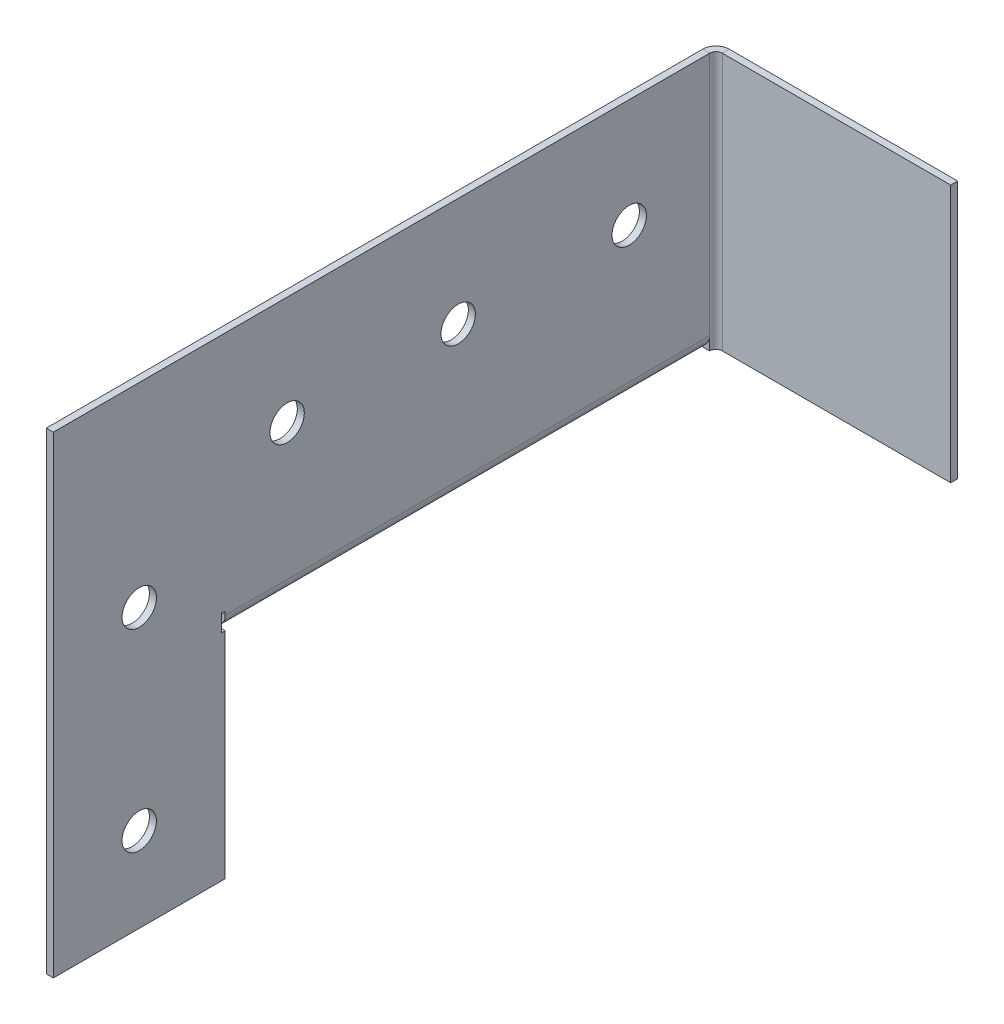
from build123d import *

# Parameters (mm, degrees)
SKETCH1_W                    = 28.1256
SKETCH1_H                    = 30
BASE_FLANGE2_DEPTH           = 0.8128
EDGE_FLANGE3_STRIP_W         = 4.7244
EDGE_FLANGE3_STRIP_H         = 0.8128
EDGE_FLANGE3_STRIP_CUT_DEPTH = 30
EDGE_FLANGE3_DEPTH           = 30
EDGE_FLANGE3_FLAT_DEPTH      = 0.8128
EDGE_FLANGE4_START           = 0.7366
EDGE_FLANGE4_DEPTH           = 56.7698
EDGE_FLANGE4_START_2         = 57.1
EDGE_FLANGE4_2_DEPTH         = 0.4064
EDGE_FLANGE4_3_DEPTH         = 56.3634
CUT_EXTRUDE1_REACH           = 93.299
SKETCH22_R                   = 2
CUT_EXTRUDE2_REACH           = 89.146


# Read off the part's stored shape, not the designer's step: Edge-Flange4
# Sheet-metal steps are written as plain solids
with BuildPart() as part:
    # Sketch1 → Base-Flange2 (new body)
    with BuildSketch(Plane.XY):
        Rectangle(SKETCH1_W, SKETCH1_H)
    extrude(amount=-BASE_FLANGE2_DEPTH)

    # Edge-Flange3 strip (across the edge) → Edge-Flange3 strip cut (cut)
    with BuildSketch(Plane(origin=(-14.0628, 15, 0), x_dir=(1, 0, 0), z_dir=(0, -1, 0))):
        with Locations((-0.8128, -0.4064)):
            Rectangle(EDGE_FLANGE3_STRIP_W, EDGE_FLANGE3_STRIP_H)
    extrude(amount=EDGE_FLANGE3_STRIP_CUT_DEPTH, mode=Mode.SUBTRACT)

    # Edge-Flange3 bend section (across the edge) → Edge-Flange3 (add)
    with BuildSketch(Plane(origin=(-14.0628, 15, 0), x_dir=(1, 0, 0), z_dir=(0, -1, 0))):
        with BuildLine():
            Line((0, 0.7366), (0.8128, 0.7366))
            ThreePointArc((0.8128, 0.7366), (1.028545145, 0.215745145), (1.5494, 0))
            Line((1.5494, 0), (1.5494, -0.8128))
            ThreePointArc((1.5494, -0.8128), (0.453808753, -0.358991247), (0, 0.7366))
        make_face()
    extrude(amount=EDGE_FLANGE3_DEPTH)

    # Edge-Flange3 profile (on flange) → Edge-Flange3 flat (add)
    with BuildSketch(Plane(origin=(-14.0628, 0, 0), x_dir=(0, -1, 0), z_dir=(-1, 0, 0))):
        Polygon((-15, 0.7366), (15, 0.7366), (15, 57.1), (40, 57.1), (40, 77.1), (-15, 77.1), align=None)
    extrude(amount=-EDGE_FLANGE3_FLAT_DEPTH)

    # Edge-Flange4 outline → Edge-Flange4 (cut)
    with BuildSketch(Plane.XY.offset(EDGE_FLANGE4_START)):
        with BuildLine():
            ThreePointArc((-13.25, -13.4506), (-13.468624211, -14.244121367), (-14.0628, -14.813707039))
            Line((-14.0628, -14.813707039), (-14.0628, -15))
            Line((-14.0628, -15), (-13.25, -15))
            Line((-13.25, -15), (-13.25, -13.4506))
        make_face()
    extrude(amount=EDGE_FLANGE4_DEPTH, mode=Mode.SUBTRACT)

    # Edge-Flange4 2 outline → Edge-Flange4 2 (cut)
    with BuildSketch(Plane.XY.offset(EDGE_FLANGE4_START_2)):
        with BuildLine():
            Line((-14.0628, -13.0442), (-14.0628, -14.813707039))
            ThreePointArc((-14.0628, -14.813707039), (-13.468624211, -14.244121367), (-13.25, -13.4506))
            Line((-13.25, -13.4506), (-13.25, -13.0442))
            Line((-13.25, -13.0442), (-14.0628, -13.0442))
        make_face()
    extrude(amount=EDGE_FLANGE4_2_DEPTH, mode=Mode.SUBTRACT)

    # Edge-Flange4 3 outline → Edge-Flange4 3 (add)
    with BuildSketch(Plane.XY.offset(EDGE_FLANGE4_START)):
        with BuildLine():
            Line((-28.25, -15), (-14.7994, -15))
            ThreePointArc((-14.7994, -15), (-14.419503755, -14.952704924), (-14.0628, -14.813707039))
            Line((-14.0628, -14.813707039), (-14.0628, -13.4506))
            ThreePointArc((-14.0628, -13.4506), (-14.278545145, -13.971454855), (-14.7994, -14.1872))
            Line((-14.7994, -14.1872), (-28.25, -14.1872))
            Line((-28.25, -14.1872), (-28.25, -15))
        make_face()
    extrude(amount=EDGE_FLANGE4_3_DEPTH)

    # Sketch22 → Cut-Extrude1 (cut, up to next)
    with BuildSketch(Plane.ZY.offset(14.0628), mode=Mode.PRIVATE) as cut_extrude1_sk1:
        with Locations((67.1, -30.16)):
            Circle(SKETCH22_R)
    cut_extrude1_tool1 = extrude(cut_extrude1_sk1.sketch, amount=-CUT_EXTRUDE1_REACH, mode=Mode.PRIVATE) & part.part
    # Sketch22 → Cut-Extrude1 (cut, up to next)
    with BuildSketch(Plane.ZY.offset(14.0628), mode=Mode.PRIVATE) as cut_extrude1_sk2:
        with Locations((67.1, -7.66)):
            Circle(SKETCH22_R)
    cut_extrude1_tool2 = extrude(cut_extrude1_sk2.sketch, amount=-CUT_EXTRUDE1_REACH, mode=Mode.PRIVATE) & part.part
    # Sketch22 → Cut-Extrude1 (cut, up to next)
    with BuildSketch(Plane.ZY.offset(14.0628), mode=Mode.PRIVATE) as cut_extrude1_sk3:
        with Locations((49.895058849, 2.34)):
            Circle(SKETCH22_R)
    cut_extrude1_tool3 = extrude(cut_extrude1_sk3.sketch, amount=-CUT_EXTRUDE1_REACH, mode=Mode.PRIVATE) & part.part
    # Sketch22 → Cut-Extrude1 (cut, up to next)
    with BuildSketch(Plane.ZY.offset(14.0628), mode=Mode.PRIVATE) as cut_extrude1_sk4:
        with Locations((29.995058849, 2.34)):
            Circle(SKETCH22_R)
    cut_extrude1_tool4 = extrude(cut_extrude1_sk4.sketch, amount=-CUT_EXTRUDE1_REACH, mode=Mode.PRIVATE) & part.part
    # Sketch22 → Cut-Extrude1 (cut, up to next)
    with BuildSketch(Plane.ZY.offset(14.0628), mode=Mode.PRIVATE) as cut_extrude1_sk5:
        with Locations((10.095058849, 2.34)):
            Circle(SKETCH22_R)
    cut_extrude1_tool5 = extrude(cut_extrude1_sk5.sketch, amount=-CUT_EXTRUDE1_REACH, mode=Mode.PRIVATE) & part.part
    add(cut_extrude1_tool1.solids().sort_by_distance((-14.0628, -30.16, 67.1))[0], mode=Mode.SUBTRACT)
    add(cut_extrude1_tool2.solids().sort_by_distance((-14.0628, -7.66, 67.1))[0], mode=Mode.SUBTRACT)
    add(cut_extrude1_tool3.solids().sort_by_distance((-14.0628, 2.34, 49.895059))[0], mode=Mode.SUBTRACT)
    add(cut_extrude1_tool4.solids().sort_by_distance((-14.0628, 2.34, 29.995059))[0], mode=Mode.SUBTRACT)
    add(cut_extrude1_tool5.solids().sort_by_distance((-14.0628, 2.34, 10.095059))[0], mode=Mode.SUBTRACT)

    # Sketch23 → Cut-Extrude2 (cut, up to next)
    with BuildSketch(Plane(origin=(0, -14.1872, 0), x_dir=(1, 0, 0), z_dir=(0, 1, 0)), mode=Mode.PRIVATE) as cut_extrude2_sk1:
        with BuildLine():
            Line((-26.8128, -26.4866), (-26.8128, -18.4866))
            ThreePointArc((-26.8128, -18.4866), (-24.0628, -15.7366), (-21.3128, -18.4866))
            Line((-21.3128, -18.4866), (-21.3128, -26.4866))
            ThreePointArc((-21.3128, -26.4866), (-24.0628, -29.2366), (-26.8128, -26.4866))
        make_face()
    cut_extrude2_tool1 = extrude(cut_extrude2_sk1.sketch, amount=-CUT_EXTRUDE2_REACH, mode=Mode.PRIVATE) & part.part
    # Sketch23 → Cut-Extrude2 (cut, up to next)
    with BuildSketch(Plane(origin=(0, -14.1872, 0), x_dir=(1, 0, 0), z_dir=(0, 1, 0)), mode=Mode.PRIVATE) as cut_extrude2_sk2:
        with BuildLine():
            Line((-26.8128, -41.9866), (-26.8128, -49.9866))
            ThreePointArc((-26.8128, -49.9866), (-24.0628, -52.7366), (-21.3128, -49.9866))
            Line((-21.3128, -49.9866), (-21.3128, -41.9866))
            ThreePointArc((-21.3128, -41.9866), (-24.0628, -39.2366), (-26.8128, -41.9866))
        make_face()
    cut_extrude2_tool2 = extrude(cut_extrude2_sk2.sketch, amount=-CUT_EXTRUDE2_REACH, mode=Mode.PRIVATE) & part.part
    add(cut_extrude2_tool1.solids().sort_by_distance((-24.0628, -14.1872, 22.4866))[0], mode=Mode.SUBTRACT)
    add(cut_extrude2_tool2.solids().sort_by_distance((-24.0628, -14.1872, 45.9866))[0], mode=Mode.SUBTRACT)


solid = part.part
